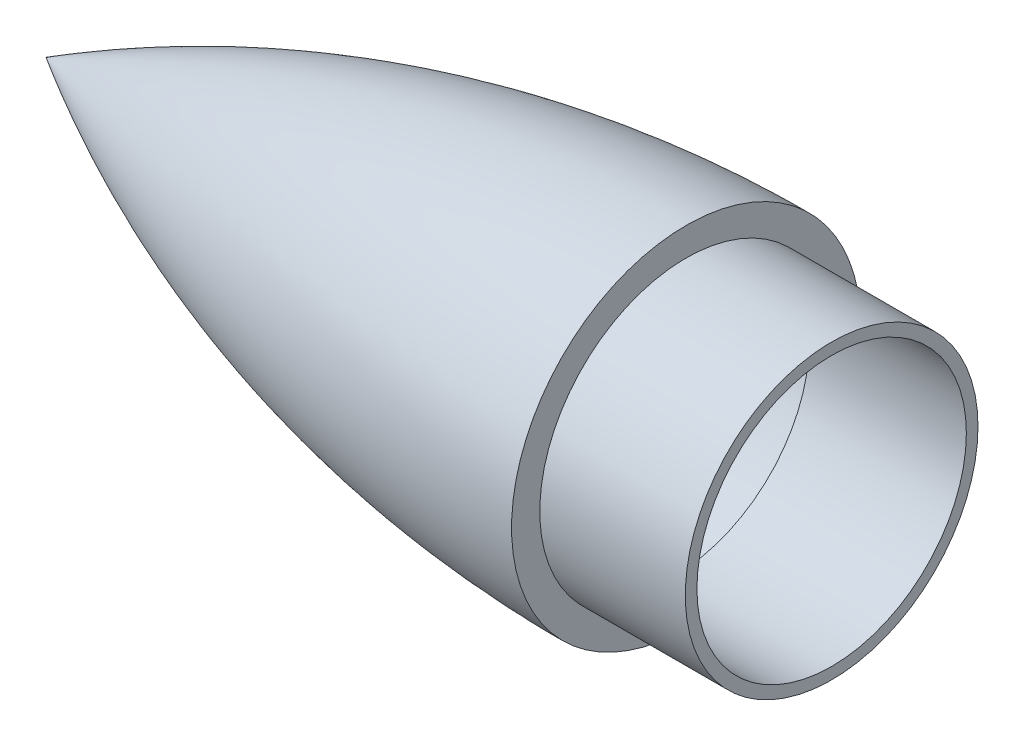
from build123d import *

# Parameters (mm, degrees)
SKETCH4_R           = 25.15
BOSS_EXTRUDE2_DEPTH = 25


# Read off the part's stored shape, not the designer's step: Shell2
with BuildPart() as part:
    # Sketch2 → Revolve2 (revolve)
    with BuildSketch(Plane.XY):
        with BuildLine():
            Line((0, 216.6666), (0, 186.6666))
            Line((0, 186.6666), (-109.999981818, 186.6666))
            ThreePointArc((-109.999981818, 186.6666), (-57.008762484, 209.032094559), (0, 216.6666))
        make_face()
    revolve(axis=Axis((0, 186.6666, 0), (-1, 0, 0)))

    # Sketch4 → Boss-Extrude2 (add)
    with BuildSketch(Plane(origin=(0, 0, 0), x_dir=(0, 0, -1), z_dir=(1, 0, 0))):
        with Locations((0, 186.6666)):
            Circle(SKETCH4_R)
    extrude(amount=BOSS_EXTRUDE2_DEPTH)

    # Shell2 outline → Shell2 (revolve, cut)
    with BuildSketch(Plane(origin=(0, 186.6666, 0), x_dir=(0, 1, 0), z_dir=(0, 0, -1))):
        with BuildLine():
            add(Edge.make_bspline(
                [(0, -106.006271513), (6.360486495, -94.806081453), (11.942359417, -83.020601398), (16.640543946, -70.760031889), (20.385035241, -58.159191232), (23.602674875, -43.280109635), (24.02910404, -41.181846651), (24.429179154, -39.079248387), (24.802825193, -36.972976187), (26.228776078, -28.309520355), (27.051970694, -21.726234977), (27.618293749, -15.133894358), (27.929635415, -8.552157048), (27.990683025, -2)],
                knots=[5.766710084, 5.766710084, 5.766710084, 5.766710084, 5.766710084, 5.766710084, 6.069954742, 6.069954742, 6.069954742, 6.069954742, 6.119601392, 6.119601392, 6.119601392, 6.119601392, 6.273868399, 6.273868399, 6.273868399, 6.273868399, 6.273868399, 6.273868399], degree=5, weights=[1, 1, 0.999949363, 0.999947726, 1, 1, 0.999999962, 0.999999962, 1, 1, 0.999996731, 0.999996826, 1, 1]))
            Line((27.990683025, -2), (23.15, -2))
            Line((23.15, -2), (23.15, 25))
            Line((23.15, 25), (0, 25))
            Line((0, 25), (0, -106.006271513))
        make_face()
    revolve(axis=Axis((0, 186.6666, 0), (1, 0, 0)), mode=Mode.SUBTRACT)


solid = part.part
